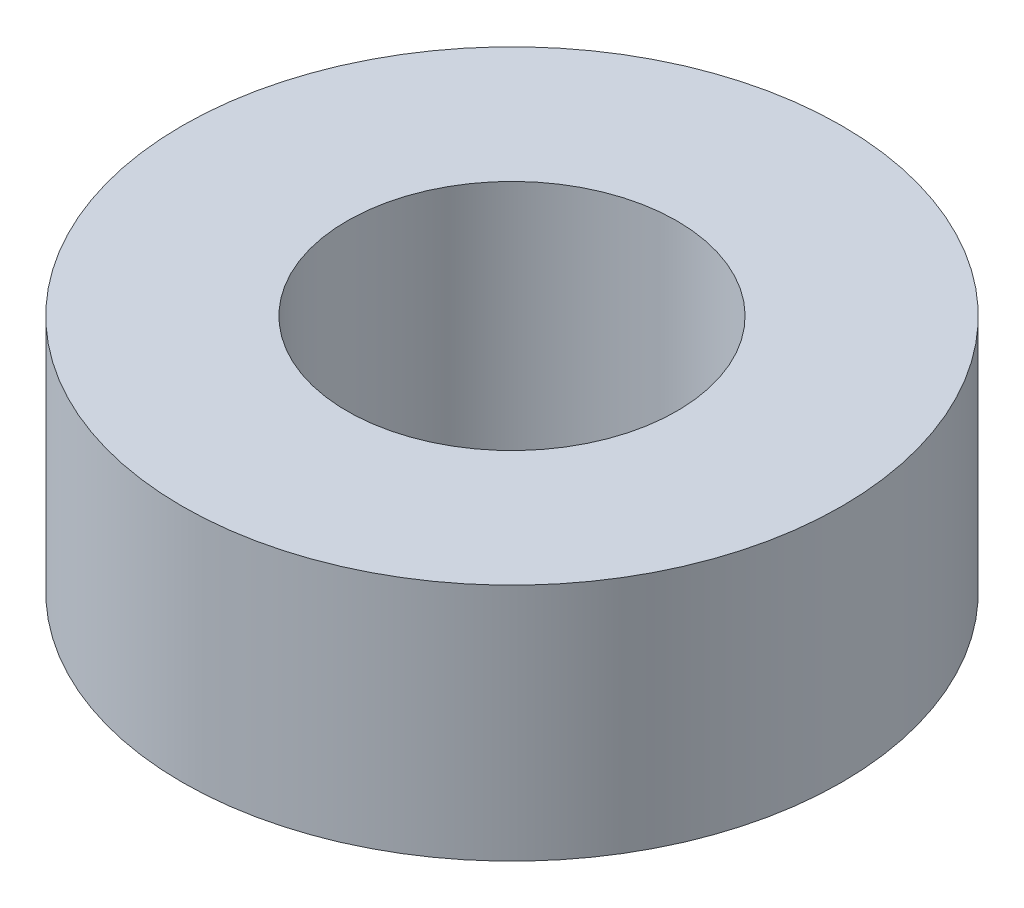
from build123d import *

# Parameters (mm, degrees)
SKETCH1_R           = 40
BOSS_EXTRUDE1_DEPTH = 29
SKETCH2_R           = 20
CUT_EXTRUDE1_DEPTH  = 64.568860301


with BuildPart() as part:
    # Sketch1 → Boss-Extrude1 (new body)
    with BuildSketch(Plane(origin=(0, 0, 0), x_dir=(1, 0, 0), z_dir=(0, 1, 0))):
        Circle(SKETCH1_R)
    extrude(amount=BOSS_EXTRUDE1_DEPTH)

    # Sketch2 → Cut-Extrude1 (cut, through all)
    with BuildSketch(Plane(origin=(0, 0, 0), x_dir=(1, 0, 0), z_dir=(0, 1, 0))):
        Circle(SKETCH2_R)
    extrude(amount=CUT_EXTRUDE1_DEPTH, mode=Mode.SUBTRACT)


solid = part.part
